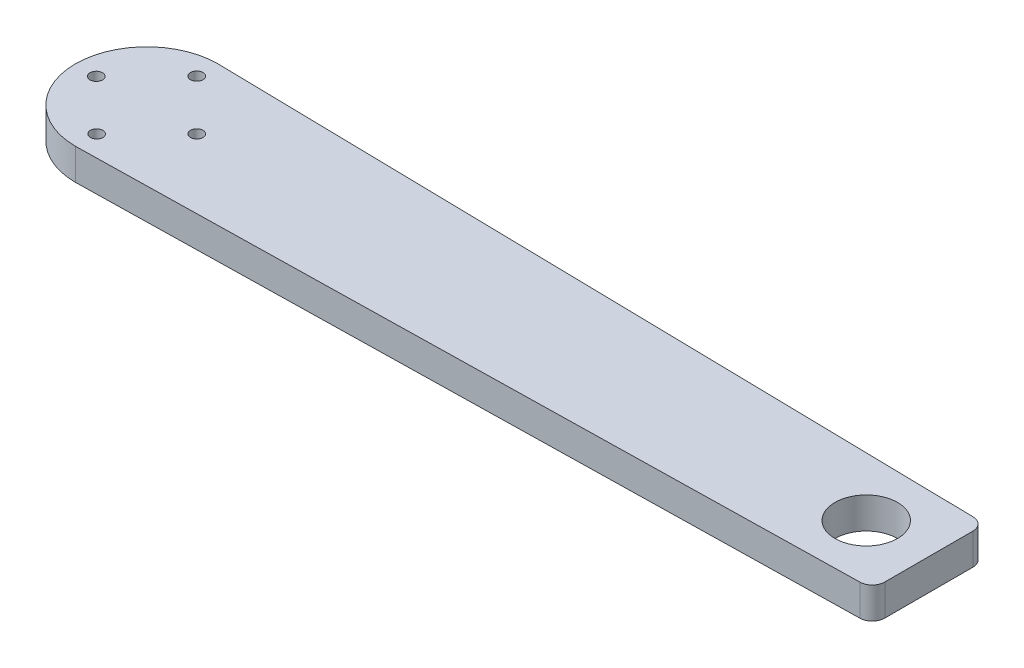
from build123d import *

# Parameters (mm, degrees)
CROQUIS1_R              = 5
CROQUIS1_R_2            = 1
SALIENTE_EXTRUIR1_DEPTH = 5
REDONDEO1_R             = 2


with BuildPart() as part:
    # Croquis1 → Saliente-Extruir1 (new body)
    with BuildSketch(Plane(origin=(0, 0, 0), x_dir=(1, 0, 0), z_dir=(0, 1, 0))):
        with BuildLine():
            Line((125, -9), (125, 9))
            Line((125, 9), (0, 11.4))
            ThreePointArc((0, 11.4), (-11.4, 0), (0, -11.4))
            Line((0, -11.4), (125, -9))
        make_face()
        with Locations((115, 0)):
            Circle(CROQUIS1_R, mode=Mode.SUBTRACT)
        with Locations((-8, -0.055168642)):
            Circle(CROQUIS1_R_2, mode=Mode.SUBTRACT)
        with Locations((0, -8)):
            Circle(CROQUIS1_R_2, mode=Mode.SUBTRACT)
        with Locations((0, 8)):
            Circle(CROQUIS1_R_2, mode=Mode.SUBTRACT)
        with Locations((8, 0)):
            Circle(CROQUIS1_R_2, mode=Mode.SUBTRACT)
    extrude(amount=SALIENTE_EXTRUIR1_DEPTH)

    # Redondeo1
    redondeo1_edges = [part.edges().sort_by_distance(p)[0] for p in [
        (125, 2.5, 9),
        (125, 2.5, -9),
    ]]
    fillet(redondeo1_edges, radius=REDONDEO1_R)


solid = part.part
